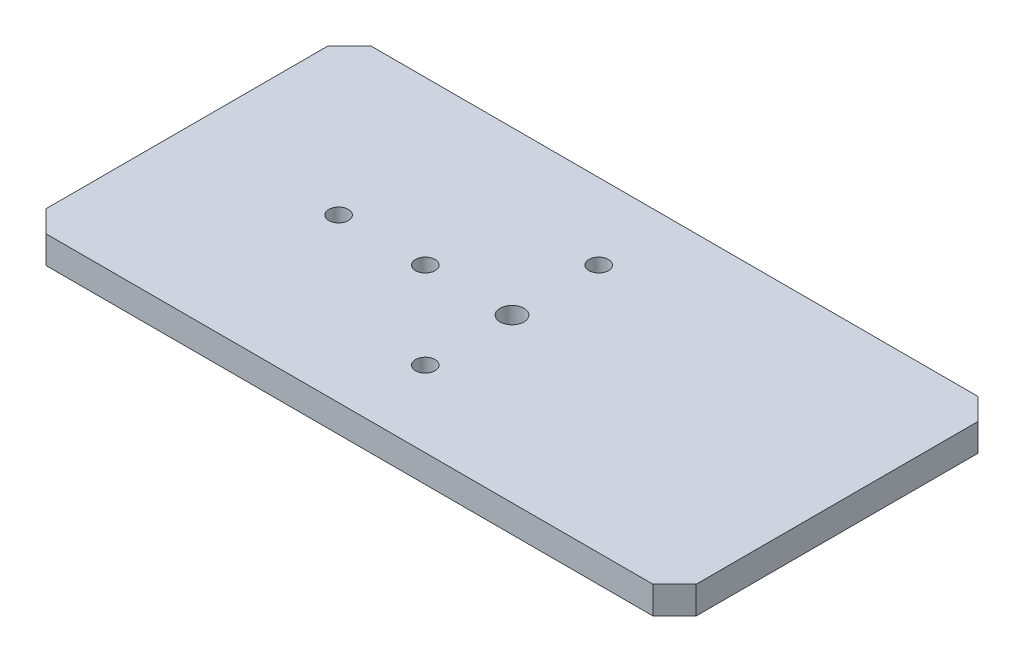
from build123d import *

# Parameters (mm, degrees)
BASE_FLANGE1_START     = -75
BASE_FLANGE1_OUTLINE_W = 300
BASE_FLANGE1_OUTLINE_H = 12.7
BASE_FLANGE1_DEPTH     = 150
M10_CLEARANCE_HOLE1_D  = 11
M8_CLEARANCE_HOLE1_D   = 9
CHAMFER1_SIZE          = 10


# Read off the part's stored shape, not the designer's step: Base-Flange1
with BuildPart() as part:
    # Base-Flange1 outline → Base-Flange1 (new body)
    with BuildSketch(Plane.XY.offset(BASE_FLANGE1_START)):
        with Locations((0, -6.35)):
            Rectangle(BASE_FLANGE1_OUTLINE_W, BASE_FLANGE1_OUTLINE_H)
    extrude(amount=BASE_FLANGE1_DEPTH)

    # M10 Clearance Hole1 (through all)
    with Locations(Plane(origin=(0, 0, 0), x_dir=(1, 0, 0), z_dir=(0, 1, 0))):
        with Locations((0, 0)):
            Hole(M10_CLEARANCE_HOLE1_D / 2)

    # M8 Clearance Hole1 (through all)
    with Locations(Plane(origin=(0, 0, 0), x_dir=(1, 0, 0), z_dir=(0, 1, 0))):
        with Locations((-40, 0), (0, -40), (0, 40), (-80, 0)):
            Hole(M8_CLEARANCE_HOLE1_D / 2)

    # Chamfer1
    chamfer1_edges = [part.edges().sort_by_distance(p)[0] for p in [
        (-150, -6.35, 75),
        (-150, -6.35, -75),
        (150, -6.35, -75),
        (150, -6.35, 75),
    ]]
    chamfer(chamfer1_edges, length=CHAMFER1_SIZE)


solid = part.part
